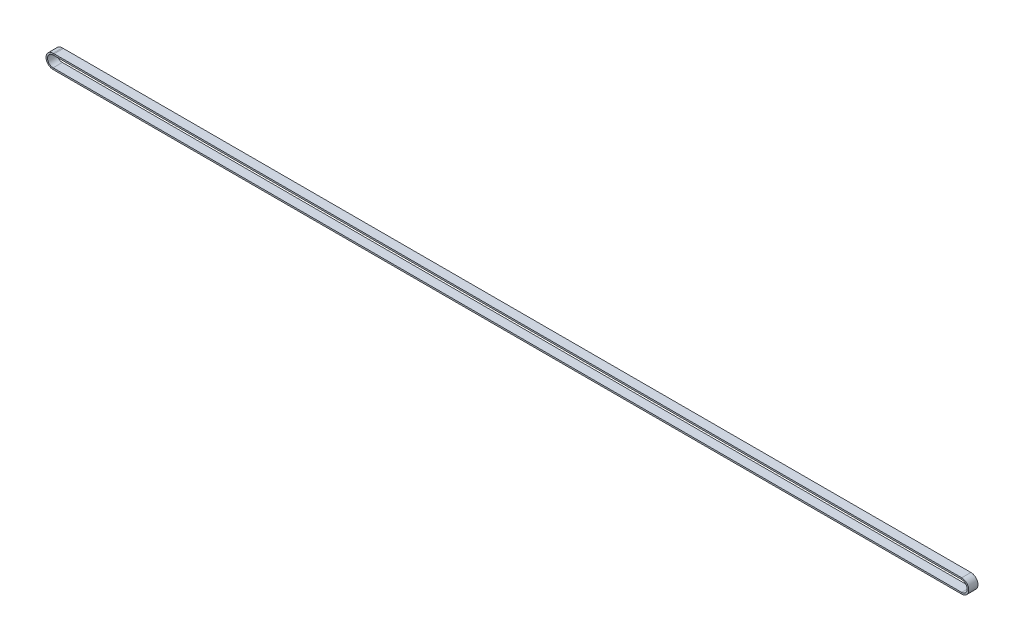
from build123d import *

# Parameters (mm, degrees)
SKETCH3_W = 9
SKETCH3_H = 1.5


with BuildPart() as part:
    # Sweep1: sweep along a path in Sketch2
    with BuildLine(Plane.XY.offset(-62.483366658)) as sweep1_path:
        Line((-1, -249.662042205), (883.520637828, -249.662042205))
        ThreePointArc((883.520637828, -249.662042205), (890.420637828, -256.562042205), (883.520637828, -263.462042205))
        Line((883.520637828, -263.462042205), (-1, -263.462042205))
        ThreePointArc((-1, -263.462042205), (-7.9, -256.562042205), (-1, -249.662042205))
    # Sketch3 → Sweep1 (sweep)
    with BuildSketch(Plane(origin=(0, 0, 0), x_dir=(0, 0, -1), z_dir=(1, 0, 0))):
        with Locations((57.983366658, -250.412042205)):
            Rectangle(SKETCH3_W, SKETCH3_H)
    sweep(path=sweep1_path.line)


solid = part.part
